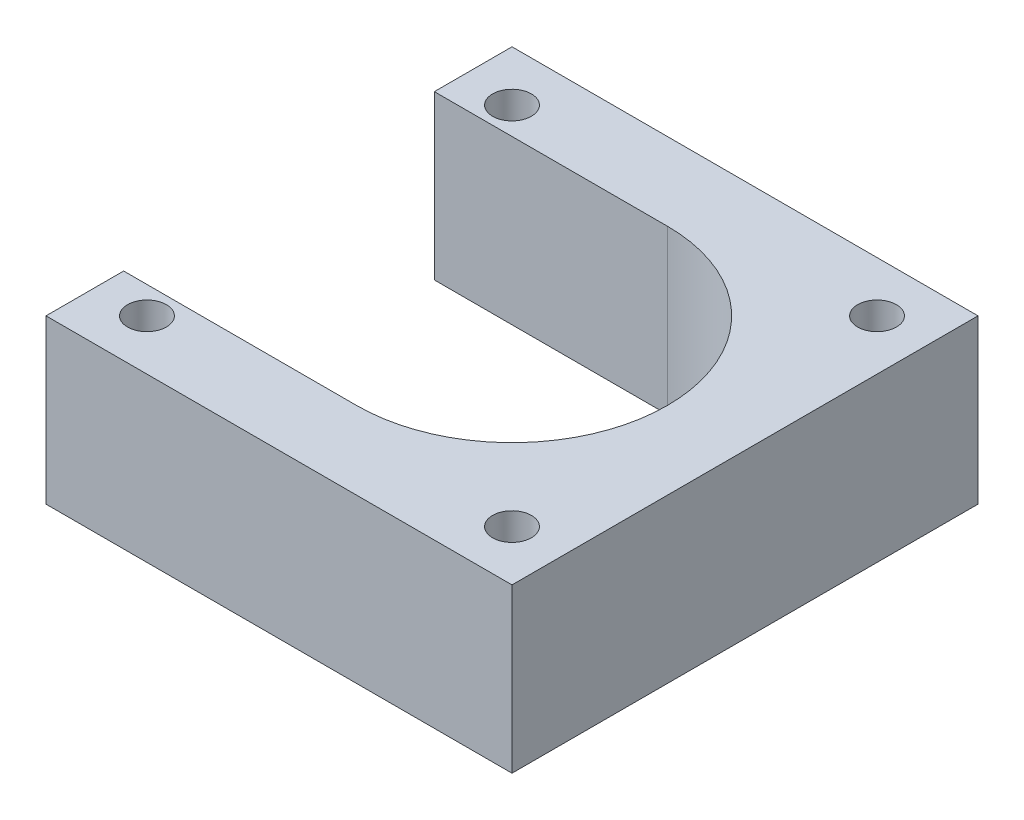
from build123d import *

# Parameters (mm, degrees)
SKETCH1_R           = 2.5
BOSS_EXTRUDE1_DEPTH = 21


with BuildPart() as part:
    # Sketch1 → Boss-Extrude1 (new body)
    with BuildSketch(Plane(origin=(0, 0, 0), x_dir=(1, 0, 0), z_dir=(0, 1, 0))):
        with BuildLine():
            Line((0, 20), (-30, 20))
            Line((-30, 20), (-30, 30))
            Line((-30, 30), (30, 30))
            Line((30, 30), (30, -30))
            Line((30, -30), (-30, -30))
            Line((-30, -30), (-30, -20))
            Line((-30, -20), (0, -20))
            ThreePointArc((0, -20), (20, 0), (0, 20))
        make_face()
        with Locations((-23.5, 23.5)):
            Circle(SKETCH1_R, mode=Mode.SUBTRACT)
        with Locations((23.5, 23.5)):
            Circle(SKETCH1_R, mode=Mode.SUBTRACT)
        with Locations((-23.5, -23.5)):
            Circle(SKETCH1_R, mode=Mode.SUBTRACT)
        with Locations((23.5, -23.5)):
            Circle(SKETCH1_R, mode=Mode.SUBTRACT)
    extrude(amount=BOSS_EXTRUDE1_DEPTH)


solid = part.part
